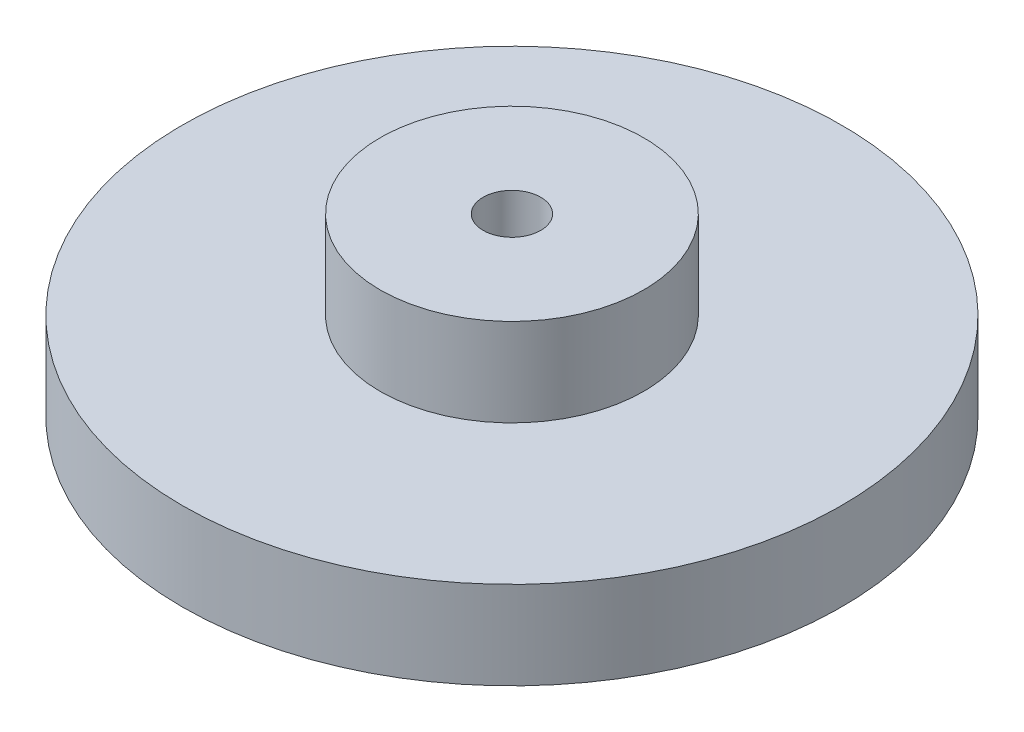
from build123d import *

# Parameters (mm, degrees)
SKETCH1_R           = 7.5
BOSS_EXTRUDE1_DEPTH = 2
SKETCH2_R           = 3
BOSS_EXTRUDE2_DEPTH = 2
SKETCH3_R           = 0.655
CUT_EXTRUDE1_DEPTH  = 2.89
SKETCH4_R           = 0.655
CUT_EXTRUDE3_DEPTH  = 1.11
CUT_EXTRUDE3_DRAFT  = 60


with BuildPart() as part:
    # Sketch1 → Boss-Extrude1 (new body)
    with BuildSketch(Plane(origin=(0, 0, 0), x_dir=(1, 0, 0), z_dir=(0, 1, 0))):
        Circle(SKETCH1_R)
    extrude(amount=BOSS_EXTRUDE1_DEPTH)

    # Sketch2 → Boss-Extrude2 (add)
    with BuildSketch(Plane(origin=(0, 2, 0), x_dir=(1, 0, 0), z_dir=(0, 1, 0))):
        Circle(SKETCH2_R)
    extrude(amount=BOSS_EXTRUDE2_DEPTH)

    # Sketch3 → Cut-Extrude1 (cut)
    with BuildSketch(Plane(origin=(0, 4, 0), x_dir=(1, 0, 0), z_dir=(0, 1, 0))):
        Circle(SKETCH3_R)
    extrude(amount=-CUT_EXTRUDE1_DEPTH, mode=Mode.SUBTRACT)


with BuildPart() as cut_extrude3_tool:
    # Sketch4 → Cut-Extrude3 (with draft: the straight prism first)
    with BuildSketch(Plane(origin=(0, 1.11, 0), x_dir=(1, 0, 0), z_dir=(0, 1, 0))):
        Circle(SKETCH4_R)
    extrude(amount=-CUT_EXTRUDE3_DEPTH)
    # Cut-Extrude3: the draft: its side faces are tilted about the plane it starts from
    cut_extrude3_sides = [cut_extrude3_tool.faces().sort_by_distance(p)[0] for p in [
        (-0.655, 0.555, 0),
    ]]
    draft(cut_extrude3_sides, Plane(origin=(0, 1.11, 0), x_dir=(1, 0, 0), z_dir=(0, 1, 0)), CUT_EXTRUDE3_DRAFT)


with BuildPart() as part_1:
    add(part.part)

    # Cut-Extrude3: cut by cut_extrude3_tool
    add(cut_extrude3_tool.part, mode=Mode.SUBTRACT)


solid = part_1.part
